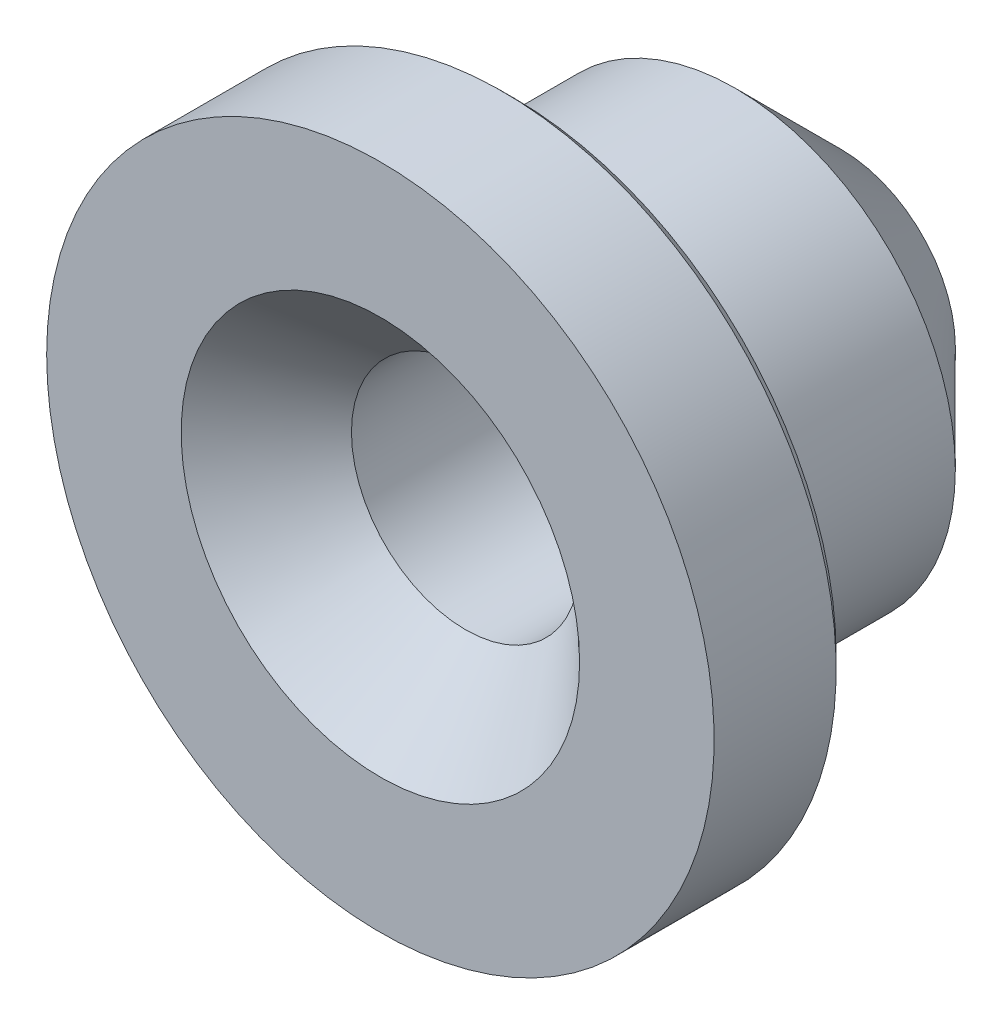
from build123d import *

# Parameters (mm, degrees)
SKETCH1_R                         = 4.9276
BOSS_EXTRUDE1_DEPTH               = 7.9375
SKETCH4_R                         = 4.9276
BOSS_EXTRUDE2_DEPTH               = 3.175
BOSS_EXTRUDE2_TAPER               = 45
F_1_4_20_TAPPED_HOLE1_D           = 5.1054
F_1_4_20_TAPPED_HOLE1_DEPTH       = 16.51
F_1_4_20_TAPPED_HOLE1_CSINK_D     = 8.9154
F_1_4_20_TAPPED_HOLE1_CSINK_ANGLE = 90
F_1_4_20_TAPPED_HOLE1_TIP         = 1.533816902
SKETCH5_W                         = 2.54
SKETCH5_H                         = 2.9845
CHAMFER1_SIZE                     = 0.254


with BuildPart() as part:
    # Sketch1 → Boss-Extrude1 (new body)
    with BuildSketch(Plane.XY):
        with Locations((-11.193990041, 3.085910768)):
            Circle(SKETCH1_R)
    extrude(amount=BOSS_EXTRUDE1_DEPTH)

    # Sketch4 → Boss-Extrude2 (add)
    with BuildSketch(Plane(origin=(0, 0, 0), x_dir=(-1, 0, 0), z_dir=(0, 0, -1))):
        with Locations((11.193990041, 3.085910768)):
            Circle(SKETCH4_R)
    extrude(amount=BOSS_EXTRUDE2_DEPTH, taper=BOSS_EXTRUDE2_TAPER)

    # 1/4-20 Tapped Hole1
    with Locations(Plane.XY.offset(7.9375)):
        with Locations((-11.193990041, 3.085910768)):
            CounterSinkHole(F_1_4_20_TAPPED_HOLE1_D / 2, F_1_4_20_TAPPED_HOLE1_CSINK_D / 2, depth=F_1_4_20_TAPPED_HOLE1_DEPTH, counter_sink_angle=F_1_4_20_TAPPED_HOLE1_CSINK_ANGLE)
            with Locations((0, 0, -(F_1_4_20_TAPPED_HOLE1_DEPTH + F_1_4_20_TAPPED_HOLE1_TIP / 2))):  # 118° drill point
                Cone(0, F_1_4_20_TAPPED_HOLE1_D / 2, F_1_4_20_TAPPED_HOLE1_TIP, mode=Mode.SUBTRACT)

    # Sketch5 → Revolve1 (revolve)
    with BuildSketch(Plane(origin=(0, 3.085910768, 0), x_dir=(1, 0, 0), z_dir=(0, 1, 0))):
        with Locations((-17.391590041, -6.44525)):
            Rectangle(SKETCH5_W, SKETCH5_H)
    revolve(axis=Axis((-11.193990041, 3.085910768, -2.3749), (0, 0, 1)))

    # Chamfer1
    chamfer1_edges = [part.edges().sort_by_distance(p)[0] for p in [
        (-3.726390041, 3.085910768, 4.953),
    ]]
    chamfer(chamfer1_edges, length=CHAMFER1_SIZE)


solid = part.part
